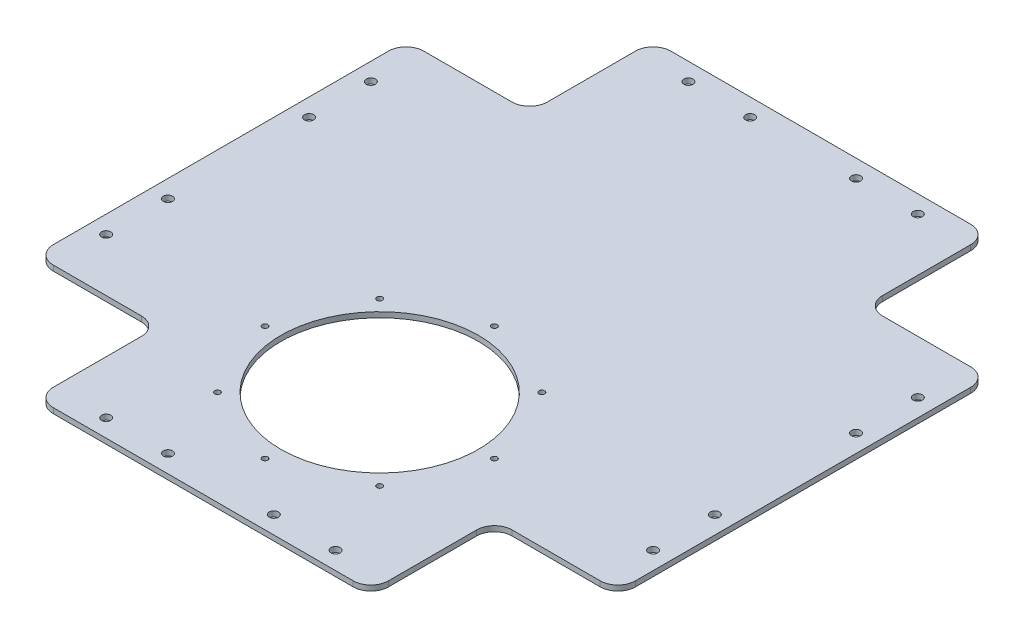
from build123d import *

# Parameters (mm, degrees)
SKETCH1_R           = 56
BOSS_EXTRUDE1_DEPTH = 3
FILLET1_R           = 10
SKETCH2_R           = 2.6
SKETCH2_R_2         = 1.6
CUT_EXTRUDE1_DEPTH  = 482.049893462


with BuildPart() as part:
    # Sketch1 → Boss-Extrude1 (new body)
    with BuildSketch(Plane(origin=(0, 0, 0), x_dir=(1, 0, 0), z_dir=(0, 1, 0))):
        Polygon((70, 70), (70, 0), (260, 0), (260, 70), (330, 70), (330, 280), (260, 280), (260, 350), (70, 350), (70, 280), (0, 280), (0, 70), align=None)
        with Locations((165, 100)):
            Circle(SKETCH1_R, mode=Mode.SUBTRACT)
    extrude(amount=BOSS_EXTRUDE1_DEPTH)

    # Fillet1
    fillet1_edges = [part.edges().sort_by_distance(p)[0] for p in [
        (330, 1.5, -280),
        (260, 1.5, -350),
        (260, 1.5, -280),
        (70, 1.5, -280),
        (70, 1.5, -350),
        (0, 1.5, -280),
        (260, 1.5, 0),
        (330, 1.5, -70),
        (260, 1.5, -70),
        (70, 1.5, 0),
        (70, 1.5, -70),
        (0, 1.5, -70),
    ]]
    fillet(fillet1_edges, radius=FILLET1_R)

    # Sketch2 → Cut-Extrude1 (cut, through all)
    with BuildSketch(Plane(origin=(0, 3, 0), x_dir=(1, 0, 0), z_dir=(0, 1, 0))):
        with Locations((100, 340)):
            Circle(SKETCH2_R)
        with Locations((135, 340)):
            Circle(SKETCH2_R)
        with Locations((195, 340)):
            Circle(SKETCH2_R)
        with Locations((230, 340)):
            Circle(SKETCH2_R)
        with Locations((10, 250)):
            Circle(SKETCH2_R)
        with Locations((10, 215)):
            Circle(SKETCH2_R)
        with Locations((10, 100)):
            Circle(SKETCH2_R)
        with Locations((10, 135)):
            Circle(SKETCH2_R)
        with Locations((100, 10)):
            Circle(SKETCH2_R)
        with Locations((135, 10)):
            Circle(SKETCH2_R)
        with Locations((195, 10)):
            Circle(SKETCH2_R)
        with Locations((230, 10)):
            Circle(SKETCH2_R)
        with Locations((320, 100)):
            Circle(SKETCH2_R)
        with Locations((320, 135)):
            Circle(SKETCH2_R)
        with Locations((320, 250)):
            Circle(SKETCH2_R)
        with Locations((320, 215)):
            Circle(SKETCH2_R)
        with Locations((165, 165)):
            Circle(SKETCH2_R_2)
        with Locations((210.961940777, 145.961940777)):
            Circle(SKETCH2_R_2)
        with Locations((230, 100)):
            Circle(SKETCH2_R_2)
        with Locations((210.961940777, 54.038059223)):
            Circle(SKETCH2_R_2)
        with Locations((165, 35)):
            Circle(SKETCH2_R_2)
        with Locations((119.038059223, 54.038059223)):
            Circle(SKETCH2_R_2)
        with Locations((100, 100)):
            Circle(SKETCH2_R_2)
        with Locations((119.038059223, 145.961940777)):
            Circle(SKETCH2_R_2)
    extrude(amount=-CUT_EXTRUDE1_DEPTH, mode=Mode.SUBTRACT)


solid = part.part
